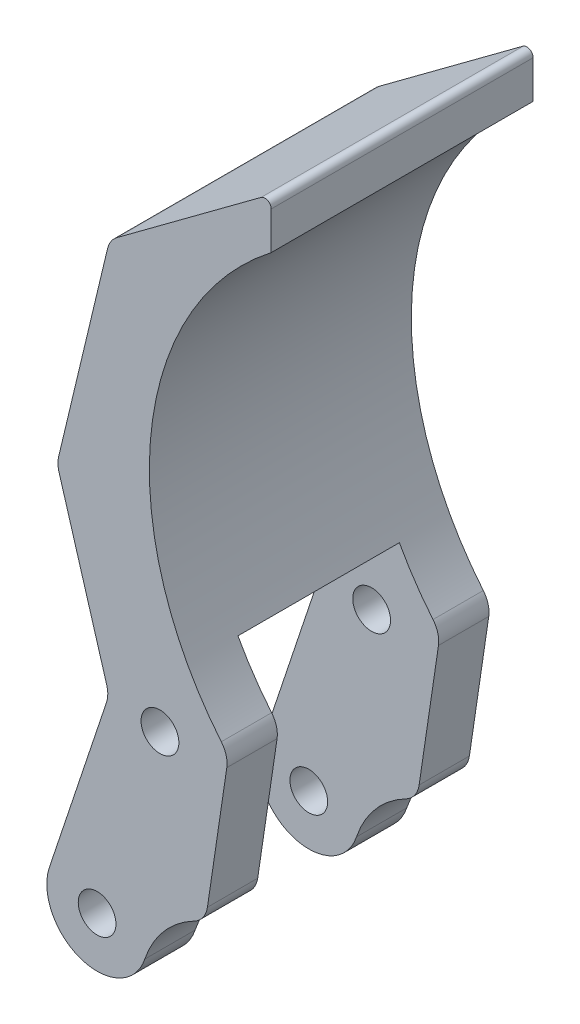
from build123d import *

# Parameters (mm, degrees)
SKETCH_1_R          = 1.5
EXTRUDE_1_DEPTH     = 4
EXTRUDE_2_DEPTH     = 20.84
EXTRUDE_START       = -4
EXTRUDE_3_DEPTH     = 4
CUT_EXTRUDE_1_DEPTH = 86.104469456
SKETCH_15_R         = 1.5
CUT_EXTRUDE_2_DEPTH = 86.104469456


with BuildPart() as part:
    # 草图1 → 凸台-拉伸1 (new body)
    with BuildSketch(Plane.XY):
        with BuildLine():
            Line((-8.883361298, 38.430372232), (-10.42356995, 28.043950456))
            ThreePointArc((-10.42356995, 28.043950456), (-10.775128008, 27.17392517), (-11.484802252, 26.560003729))
            ThreePointArc((-11.484802252, 26.560003729), (-13.893149851, 24.653752275), (-15.405733358, 21.980547476))
            ThreePointArc((-15.405733358, 21.980547476), (-20.465380085, 19.450724806), (-22.995202754, 24.510371532))
            Line((-22.995202754, 24.510371532), (-18.451197233, 38.142383115))
            ThreePointArc((-18.451197233, 38.142383115), (-18.348830032, 38.742204214), (-18.431570381, 39.345046174))
            Line((-18.431570381, 39.345046174), (-22.233001172, 52.125165651))
            ThreePointArc((-22.233001172, 52.125165651), (-22.31526172, 52.64074939), (-22.261276417, 53.160055635))
            Line((-22.261276417, 53.160055635), (-18.372774426, 69.438220218))
            ThreePointArc((-18.372774426, 69.438220218), (-18.096529541, 70.075517478), (-17.618975762, 70.579899696))
            Line((-17.618975762, 70.579899696), (-6.150614111, 79.086205979))
            ThreePointArc((-6.150614111, 79.086205979), (-5.627950875, 79.131232586), (-5.352746621, 78.684615443))
            Line((-5.352746621, 78.684615443), (-5.352746621, 75.677999772))
            ThreePointArc((-5.352746621, 75.677999772), (-14.888864346, 58.677248629), (-9.31952103, 39.997165768))
            ThreePointArc((-9.31952103, 39.997165768), (-8.934989705, 39.260105305), (-8.883361298, 38.430372232))
        make_face()
        with Locations((-19.200468056, 23.245459504)):
            Circle(SKETCH_1_R, mode=Mode.SUBTRACT)
        with Locations((-14.200468056, 38.245459504)):
            Circle(SKETCH_1_R, mode=Mode.SUBTRACT)
    extrude(amount=EXTRUDE_1_DEPTH)

    # 草图9 → 凸台-拉伸2 (add)
    with BuildSketch(Plane(origin=(0, 0, 0), x_dir=(-1, 0, 0), z_dir=(0, 0, -1))):
        with BuildLine():
            Line((18.431570381, 39.345046174), (11.995527079, 43.954984078))
            ThreePointArc((11.995527079, 43.954984078), (14.51123125, 61.038775991), (5.352746621, 75.677999772))
            Line((5.352746621, 75.677999772), (5.352746621, 78.684615443))
            ThreePointArc((5.352746621, 78.684615443), (5.627950875, 79.131232586), (6.150614111, 79.086205979))
            Line((6.150614111, 79.086205979), (17.618975762, 70.579899696))
            ThreePointArc((17.618975762, 70.579899696), (18.096529541, 70.075517478), (18.372774426, 69.438220218))
            Line((18.372774426, 69.438220218), (22.261276417, 53.160055635))
            ThreePointArc((22.261276417, 53.160055635), (22.31526172, 52.64074939), (22.233001172, 52.125165651))
            Line((22.233001172, 52.125165651), (18.431570381, 39.345046174))
        make_face()
    extrude(amount=-EXTRUDE_2_DEPTH)

    # 草图13 → 凸台-拉伸3 (add)
    with BuildSketch(Plane.XY.offset(20.84).offset(EXTRUDE_START)):
        with BuildLine():
            Line((-11.995527079, 43.954984078), (-18.431570381, 39.345046174))
            ThreePointArc((-18.431570381, 39.345046174), (-18.348830032, 38.742204214), (-18.451197233, 38.142383115))
            Line((-18.451197233, 38.142383115), (-22.995202754, 24.510371532))
            ThreePointArc((-22.995202754, 24.510371532), (-20.465380085, 19.450724806), (-15.405733358, 21.980547476))
            ThreePointArc((-15.405733358, 21.980547476), (-13.893149851, 24.653752275), (-11.484802252, 26.560003729))
            ThreePointArc((-11.484802252, 26.560003729), (-10.775128008, 27.17392517), (-10.42356995, 28.043950456))
            Line((-10.42356995, 28.043950456), (-8.883361298, 38.430372232))
            ThreePointArc((-8.883361298, 38.430372232), (-8.934989705, 39.260105305), (-9.31952103, 39.997165768))
            ThreePointArc((-9.31952103, 39.997165768), (-10.752284945, 41.91200409), (-11.995527079, 43.954984078))
        make_face()
    extrude(amount=EXTRUDE_3_DEPTH)

    # 草图14 → 切除-拉伸1 (cut, through all)
    with BuildSketch(Plane(origin=(0, 0, 0), x_dir=(-1, 0, 0), z_dir=(0, 0, -1))):
        with BuildLine():
            ThreePointArc((12.747581778, 38.634879176), (12.74980353, 38.633349016), (12.750658691, 38.630790447))
            ThreePointArc((12.750658691, 38.630790447), (12.749034684, 38.627446317), (12.745402307, 38.62665484))
            ThreePointArc((12.745402307, 38.62665484), (14.00829556, 36.753616366), (15.704637667, 38.245459504))
            ThreePointArc((15.704637667, 38.245459504), (14.396859032, 39.736753171), (12.747581778, 38.634879176))
        make_face()
    extrude(amount=-CUT_EXTRUDE_1_DEPTH, mode=Mode.SUBTRACT)

    # 草图15 → 切除-拉伸2 (cut, through all)
    with BuildSketch(Plane(origin=(0, 0, 0), x_dir=(-1, 0, 0), z_dir=(0, 0, -1))):
        with Locations((19.200468056, 23.245459504)):
            Circle(SKETCH_15_R)
    extrude(amount=-CUT_EXTRUDE_2_DEPTH, mode=Mode.SUBTRACT)


solid = part.part
